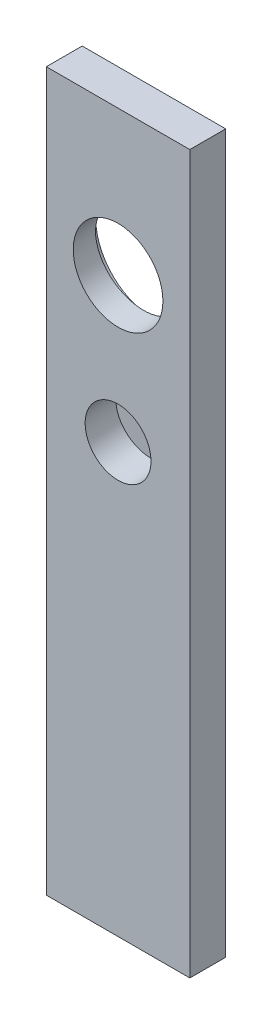
from build123d import *

# Parameters (mm, degrees)
SKETCH1_W           = 80
SKETCH1_H           = 400
BOSS_EXTRUDE1_DEPTH = 20
SKETCH4_R           = 32.5
CUT_EXTRUDE4_DEPTH  = 206.087962432
SKETCH6_R           = 25
CUT_EXTRUDE6_DEPTH  = 206.087962432
SKETCH12_R          = 18.35
CUT_EXTRUDE8_DEPTH  = 205.939015319
SKETCH13_R          = 6
CUT_EXTRUDE9_DEPTH  = 205.939015319


with BuildPart() as part:
    # Sketch1 → Boss-Extrude1 (new body)
    with BuildSketch(Plane.XY):
        Rectangle(SKETCH1_W, SKETCH1_H)
    extrude(amount=BOSS_EXTRUDE1_DEPTH)

    # Sketch4 → Cut-Extrude4 (cut, through all)
    with BuildSketch(Plane(origin=(0, 0.062016747, -0.8868808), x_dir=(1, 0, 0), z_dir=(0, 0.06975647374412192, -0.9975640502598245))):
        with Locations((0, -120.405250769)):
            Circle(SKETCH4_R)
    extrude(amount=CUT_EXTRUDE4_DEPTH, mode=Mode.SUBTRACT)

    # Sketch6 → Cut-Extrude6 (cut, through all)
    with BuildSketch(Plane(origin=(0, 0.062016747, -0.8868808), x_dir=(-1, 0, 0), z_dir=(0, 0.06975647374412192, -0.9975640502598246))):
        with Locations((0, 120.405250769)):
            Circle(SKETCH6_R)
    extrude(amount=-CUT_EXTRUDE6_DEPTH, mode=Mode.SUBTRACT)

    # Sketch12 → Cut-Extrude8 (cut, through all)
    with BuildSketch(Plane(origin=(0, 0, 0), x_dir=(1, 0, 0), z_dir=(0, -0.06975647374412544, 0.9975640502598243))):
        with Locations((0, 40)):
            Circle(SKETCH12_R)
    extrude(amount=CUT_EXTRUDE8_DEPTH, mode=Mode.SUBTRACT)

    # Sketch13 → Cut-Extrude9 (cut, through all)
    with BuildSketch(Plane(origin=(0, 0, 0), x_dir=(1, 0, 0), z_dir=(0, -0.06975647374412543, 0.9975640502598243))):
        with Locations((0, 46.65)):
            Circle(SKETCH13_R)
    extrude(amount=-CUT_EXTRUDE9_DEPTH, mode=Mode.SUBTRACT)


solid = part.part
